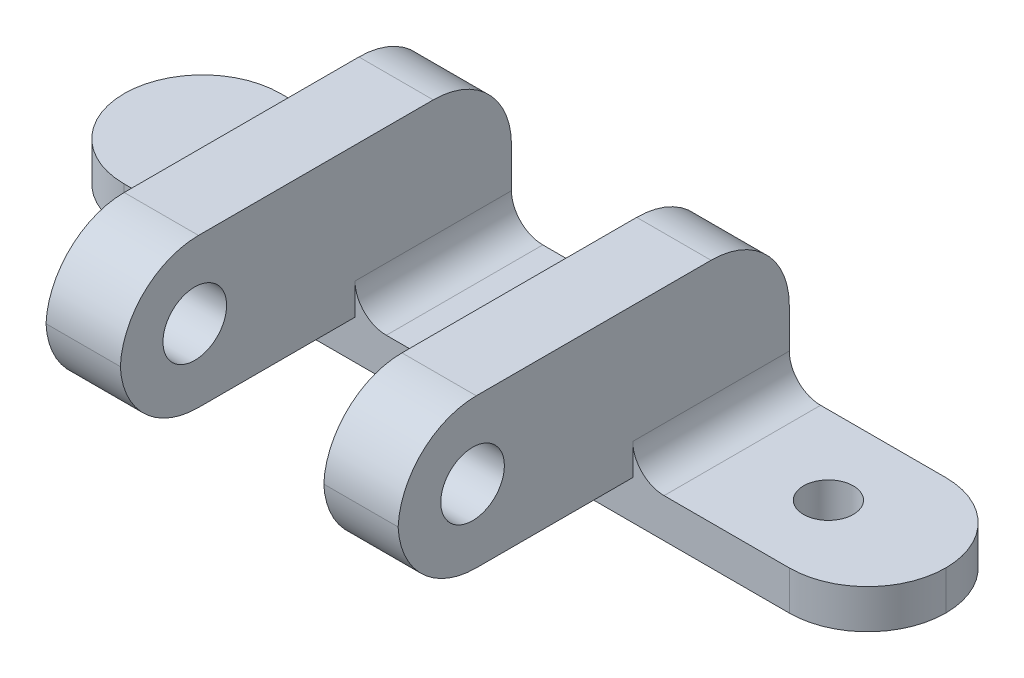
from build123d import *

# Parameters (mm, degrees)
SKETCH1_W                   = 45
SKETCH1_H                   = 20
BOSS_EXTRUDE1_DEPTH         = 5
SKETCH2_W                   = 9.5
SKETCH2_H                   = 20
BOSS_EXTRUDE2_DEPTH         = 19.05
SKETCH3_W                   = 9.5
SKETCH3_H                   = 19.05
BOSS_EXTRUDE3_DEPTH         = 30
SKETCH4_R                   = 4.064
CUT_EXTRUDE1_DEPTH          = 65.833652527
SKETCH8_W                   = 30
SKETCH8_H                   = 20
BOSS_EXTRUDE4_DEPTH         = 5
F_1_4_0_25_DIAMETER_HOLE1_D = 6.35
FILLET1_R                   = 10
FILLET2_R                   = 4


with BuildPart() as part:
    # Sketch1 → Boss-Extrude1 (new body)
    with BuildSketch(Plane(origin=(0, 0, 0), x_dir=(1, 0, 0), z_dir=(0, 1, 0))):
        Rectangle(SKETCH1_W, SKETCH1_H)
    extrude(amount=BOSS_EXTRUDE1_DEPTH)

    # Sketch2 → Boss-Extrude2 (add)
    with BuildSketch(Plane(origin=(0, 5, 0), x_dir=(1, 0, 0), z_dir=(0, 1, 0))):
        with Locations((17.75, 0)):
            Rectangle(SKETCH2_W, SKETCH2_H)
        with Locations((-17.75, 0)):
            Rectangle(SKETCH2_W, SKETCH2_H)
    extrude(amount=BOSS_EXTRUDE2_DEPTH)

    # Sketch3 → Boss-Extrude3 (add)
    with BuildSketch(Plane.XY.offset(10)):
        with Locations((-17.75, 14.525)):
            Rectangle(SKETCH3_W, SKETCH3_H)
        with Locations((17.75, 14.525)):
            Rectangle(SKETCH3_W, SKETCH3_H)
    extrude(amount=BOSS_EXTRUDE3_DEPTH)

    # Sketch4 → Cut-Extrude1 (cut, through all)
    with BuildSketch(Plane(origin=(22.5, 0, 0), x_dir=(0, 0, -1), z_dir=(1, 0, 0))):
        with Locations((-30.475, 14.525)):
            Circle(SKETCH4_R)
    extrude(amount=-CUT_EXTRUDE1_DEPTH, mode=Mode.SUBTRACT)

    # Sketch8 → Boss-Extrude4 (add)
    with BuildSketch(Plane(origin=(0, 5, 0), x_dir=(1, 0, 0), z_dir=(0, 1, 0))):
        with Locations((37.5, 0)):
            Rectangle(SKETCH8_W, SKETCH8_H)
        with Locations((-37.5, 0)):
            Rectangle(SKETCH8_W, SKETCH8_H)
    extrude(amount=-BOSS_EXTRUDE4_DEPTH)

    # 1/4 (0.25) Diameter Hole1 (through all)
    with Locations(Plane(origin=(0, 5, 0), x_dir=(1, 0, 0), z_dir=(0, 1, 0))):
        with Locations((37.5, 0), (-37.5, 0)):
            Hole(F_1_4_0_25_DIAMETER_HOLE1_D / 2)

    # Fillet1
    # the kernel refuses this fillet: 10 mm, written as the material it takes off along each edge
    with BuildSketch(Plane(origin=(-47.5, 24.05, -10), x_dir=(0, -1, 0), z_dir=(1, 0, 0)), Plane(origin=(12, 5, 40), x_dir=(0, 0, -1), z_dir=(-1, 0, 0)), Plane(origin=(47.5, 5, 40), x_dir=(0, 0, -1), z_dir=(-1, 0, 0))) as fillet1_piece_1:
        with BuildLine():
            CenterArc((FILLET1_R, -FILLET1_R), FILLET1_R, 90, 90)
            Line((0, -FILLET1_R), (0, 0))
            Line((0, 0), (FILLET1_R, 0))
        make_face()
    extrude(amount=59.5, mode=Mode.SUBTRACT)
    with BuildSketch(Plane(origin=(-47.5, 24.05, 40), x_dir=(0, -1, 0), z_dir=(1, 0, 0)), Plane(origin=(-12, 24.05, 40), x_dir=(0, -1, 0), z_dir=(1, 0, 0)), Plane(origin=(47.5, 24.05, -10), x_dir=(0, -1, 0), z_dir=(-1, 0, 0))) as fillet1_piece_2:
        with BuildLine():
            CenterArc((FILLET1_R, FILLET1_R), FILLET1_R, 180, 90)
            Line((0, FILLET1_R), (0, 0))
            Line((0, 0), (FILLET1_R, 0))
        make_face()
    extrude(amount=59.5, mode=Mode.SUBTRACT)
    with BuildSketch(Plane(origin=(52.5, 30, 10), x_dir=(-1, 0, 0), z_dir=(0, -1, 0)), Plane(origin=(52.5, 30, -10), x_dir=(0, 0, 1), z_dir=(0, -1, 0))) as fillet1_piece_3:
        with BuildLine():
            CenterArc((FILLET1_R, FILLET1_R), FILLET1_R, 180, 90)
            Line((0, FILLET1_R), (0, 0))
            Line((0, 0), (FILLET1_R, 0))
        make_face()
    extrude(amount=55, mode=Mode.SUBTRACT)
    with BuildSketch(Plane(origin=(-52.5, 30, 10), x_dir=(1, 0, 0), z_dir=(0, -1, 0)), Plane(origin=(-52.5, 30, -10), x_dir=(0, 0, 1), z_dir=(0, -1, 0))) as fillet1_piece_4:
        with BuildLine():
            CenterArc((FILLET1_R, -FILLET1_R), FILLET1_R, 90, 90)
            Line((0, -FILLET1_R), (0, 0))
            Line((0, 0), (FILLET1_R, 0))
        make_face()
    extrude(amount=55, mode=Mode.SUBTRACT)

    # Fillet2
    fillet2_edges = [part.edges().sort_by_distance(p)[0] for p in [
        (13, 5, 0),
        (-13, 5, 0),
        (22.5, 5, 0),
        (-22.5, 5, 0),
    ]]
    fillet(fillet2_edges, radius=FILLET2_R)


solid = part.part
